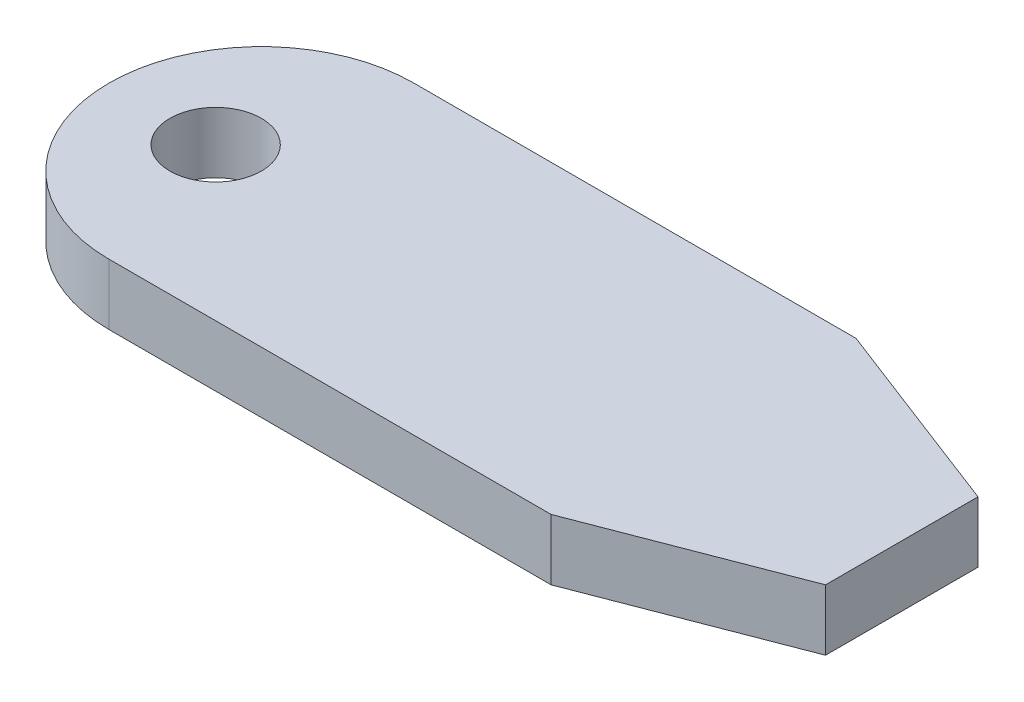
from build123d import *

# Parameters (mm, degrees)
CROQUIS1_R              = 1.5
SALIENTE_EXTRUIR1_DEPTH = 2
REDONDEO1_R             = 5


with BuildPart() as part:
    # Croquis1 → Saliente-Extruir1 (new body)
    with BuildSketch(Plane(origin=(0, 0, 0), x_dir=(1, 0, 0), z_dir=(0, 1, 0))):
        Polygon((-13, 0), (-13, 5), (0, 5), (6.5, 5), (13, 2.5), (13, 0), (13, -2.5), (6.5, -5), (0, -5), (-13, -5), align=None)
        with Locations(Location((-9.5, 0, 0), (0, 0, 270))):
            Circle(CROQUIS1_R, mode=Mode.SUBTRACT)
    extrude(amount=SALIENTE_EXTRUIR1_DEPTH)

    # Redondeo1
    redondeo1_edges = [part.edges().sort_by_distance(p)[0] for p in [
        (-13, 1, 5),
        (-13, 1, -5),
    ]]
    fillet(redondeo1_edges, radius=REDONDEO1_R - 0.0001)  # a hair under: the kernel refuses the full size


solid = part.part
